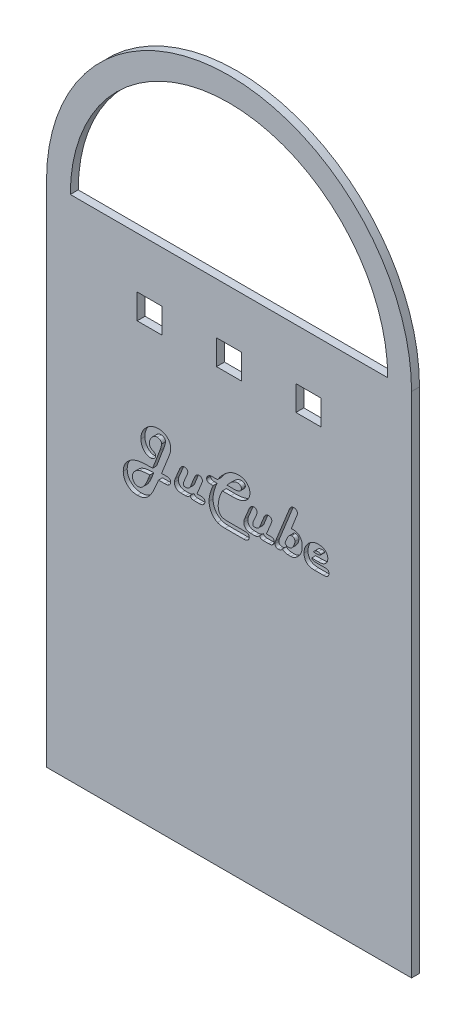
from build123d import *

# Parameters (mm, degrees)
SKETCH2_W           = 10
SKETCH2_H           = 10
BOSS_EXTRUDE5_DEPTH = 3.175
CUT_EXTRUDE2_DEPTH  = 1.5875


with BuildPart() as part:
    # Sketch2 → Boss-Extrude5 (new body)
    with BuildSketch(Plane.XY):
        with BuildLine():
            Line((0, 0), (146.05, 0))
            Line((146.05, 0), (146.05, 203.2))
            ThreePointArc((146.05, 203.2), (73.025, 276.225), (0, 203.2))
            Line((0, 203.2), (0, 0))
        make_face()
        with BuildLine():
            Line((9.525, 203.2), (136.525, 203.2))
            ThreePointArc((136.525, 203.2), (73.025, 266.7), (9.525, 203.2))
        make_face(mode=Mode.SUBTRACT)
        with Locations((41.275, 177.8)):
            Rectangle(SKETCH2_W, SKETCH2_H, mode=Mode.SUBTRACT)
        with Locations((73.025, 177.8)):
            Rectangle(SKETCH2_W, SKETCH2_H, mode=Mode.SUBTRACT)
        with Locations((104.775, 177.8)):
            Rectangle(SKETCH2_W, SKETCH2_H, mode=Mode.SUBTRACT)
    extrude(amount=BOSS_EXTRUDE5_DEPTH)

    # Sketch4 → Cut-Extrude2 (cut)
    # profile 1 of 6: a face of its own
    with BuildSketch(Plane.XY.offset(3.175)):
        with BuildLine():
            Line((46.031308631, 124.822674221), (47.941745275, 124.822674221))
            add(Edge.make_bspline(
                [(47.941745275, 124.822674221), (48.080294818, 124.819712051), (48.339712051, 124.814165747), (48.699868235, 124.756454284), (49.008684519, 124.66955094), (49.260364084, 124.534228572), (49.463707014, 124.365336185), (49.604231405, 124.150526071), (49.69180785, 123.899345289), (49.69965441, 123.718535617), (49.703761542, 123.623894255)],
                knots=[0, 0, 0, 0, 1.374766829, 2.57408433, 3.614346374, 4.544477883, 5.393131557, 6.21082457, 7.063490371, 8, 8, 8, 8], degree=3))
            add(Edge.make_bspline(
                [(49.703761542, 123.623894255), (49.697396484, 123.49602033), (49.685062487, 123.248230528), (49.561319384, 122.898163915), (49.357922028, 122.594266718), (49.077603043, 122.340136992), (48.728091218, 122.143366324), (48.319254627, 121.997884124), (47.848445679, 121.917228721), (47.515815362, 121.905904586), (47.340452467, 121.899934495)],
                knots=[0, 0, 0, 0, 0.929567561, 1.801284846, 2.668377082, 3.571806983, 4.533225673, 5.574775137, 6.721420051, 8, 8, 8, 8], degree=3))
            Line((47.340452467, 121.899934495), (44.821111714, 121.899934495))
            Line((44.821111714, 121.899934495), (43.862087741, 119.53662542))
            add(Edge.make_bspline(
                [(43.862087741, 119.53662542), (43.734031349, 119.220911014), (43.48627451, 118.610083221), (43.083855351, 117.740867242), (42.681335469, 116.942614562), (42.280934505, 116.210746535), (41.865172802, 115.557615623), (41.450118653, 114.972071586), (41.034685243, 114.454518334), (40.602867664, 114.012652023), (40.159679198, 113.627087468), (39.689882094, 113.301089703), (39.197379202, 113.019218246), (38.674018061, 112.795280128), (38.12704459, 112.615241294), (37.551993377, 112.48967888), (36.95160052, 112.41767564), (36.542746058, 112.406647284), (36.334510686, 112.401030385)],
                knots=[0, 0, 0, 0, 1.468908974, 2.841968597, 4.1287121, 5.323593136, 6.437448851, 7.465024802, 8.417576394, 9.295662056, 10.125698866, 10.94665604, 11.757436234, 12.568345582, 13.39692117, 14.237044157, 15.102101602, 16, 16, 16, 16], degree=3))
            add(Edge.make_bspline(
                [(36.334510686, 112.401030385), (36.137589531, 112.404477258), (35.75107336, 112.411242767), (35.184820769, 112.492385338), (34.64243405, 112.61116092), (34.12504618, 112.78443444), (33.632183955, 113.004925182), (33.165017373, 113.278031836), (32.72201072, 113.59842844), (32.309672983, 113.966347551), (31.935331224, 114.370673892), (31.606409204, 114.802575398), (31.32451665, 115.257197489), (31.101925243, 115.740731339), (30.920051192, 116.243921441), (30.794589163, 116.773658535), (30.72270625, 117.327356192), (30.711598915, 117.704630481), (30.705953323, 117.896389974)],
                knots=[0, 0, 0, 0, 1.074409005, 2.108846326, 3.117072076, 4.102727955, 5.08240308, 6.060117382, 7.05212911, 8.062778769, 9.072478569, 10.056063612, 11.023046353, 11.986724094, 12.957247774, 13.940052078, 14.952977764, 16, 16, 16, 16], degree=3))
            add(Edge.make_bspline(
                [(30.705953323, 117.896389974), (30.708705247, 118.042411483), (30.714151017, 118.331372744), (30.762923108, 118.759569252), (30.833550543, 119.179635621), (30.937107566, 119.591711571), (31.070463187, 119.996269011), (31.234665585, 120.391163326), (31.425516526, 120.778307478), (31.646900947, 121.153809422), (31.892461809, 121.519114946), (32.168540556, 121.866584279), (32.469834737, 122.197116295), (32.792922626, 122.513308526), (33.140316389, 122.812082061), (33.515204363, 123.08825825), (33.911385368, 123.353621282), (34.190881904, 123.51270647), (34.332738426, 123.59344905)],
                knots=[0, 0, 0, 0, 0.986633776, 1.952444828, 2.909577263, 3.864094578, 4.821227013, 5.786162288, 6.752467993, 7.73626618, 8.730323382, 9.725267674, 10.732877573, 11.751517376, 12.779174888, 13.826952509, 14.897084866, 16, 16, 16, 16], degree=3))
            add(Edge.make_bspline(
                [(34.332738426, 123.59344905), (34.523974716, 123.690830636), (34.915407749, 123.890156661), (35.5493386, 124.129380854), (36.230779762, 124.341426386), (36.967442276, 124.503827471), (37.753020843, 124.640095211), (38.592286442, 124.726446681), (39.483448447, 124.786347867), (40.095652231, 124.792745758), (40.41036257, 124.796034666)],
                knots=[0, 0, 0, 0, 0.822641494, 1.683828184, 2.595046862, 3.558297765, 4.575076227, 5.651965759, 6.792966211, 8, 8, 8, 8], degree=3))
            Line((40.41036257, 124.796034666), (42.457802638, 124.822674221))
            Line((42.457802638, 124.822674221), (45.315846303, 132.338834324))
            add(Edge.make_bspline(
                [(45.315846303, 132.338834324), (45.373565588, 132.495911057), (45.483590688, 132.795332351), (45.631175441, 133.22739868), (45.763365647, 133.617780821), (45.865587471, 133.972483942), (45.946245959, 134.287158611), (46.004262768, 134.562483476), (46.041924723, 134.798791081), (46.047710386, 134.94433087), (46.050336885, 135.010401105)],
                knots=[0, 0, 0, 0, 1.444318592, 2.753175028, 3.940779609, 5.001085105, 5.938491443, 6.743748221, 7.429703383, 8, 8, 8, 8], degree=3))
            add(Edge.make_bspline(
                [(46.050336885, 135.010401105), (46.045351981, 135.109046088), (46.035437799, 135.30523532), (45.92768989, 135.584825196), (45.765960289, 135.845554974), (45.538757287, 136.073406673), (45.274727639, 136.26980574), (44.975347082, 136.413468956), (44.65089449, 136.499982658), (44.425857603, 136.509024451), (44.311154522, 136.513633125)],
                knots=[0, 0, 0, 0, 0.926502715, 1.842667016, 2.789054029, 3.8047205, 4.857979717, 5.880393009, 6.919619551, 8, 8, 8, 8], degree=3))
            add(Edge.make_bspline(
                [(44.311154522, 136.513633125), (44.21322501, 136.50978514), (44.018465936, 136.502132391), (43.729843603, 136.446065184), (43.447522694, 136.358696049), (43.170970063, 136.235958669), (42.902767636, 136.07464067), (42.645512329, 135.873314686), (42.387620959, 135.645370203), (42.144788648, 135.381301358), (41.921248873, 135.09657287), (41.718571178, 134.803223347), (41.558045077, 134.496677445), (41.417069581, 134.186965379), (41.31122918, 133.866528377), (41.235428071, 133.539149721), (41.187457578, 133.204131763), (41.181912066, 132.978344896), (41.179104008, 132.864014118)],
                knots=[0, 0, 0, 0, 0.890503997, 1.771005816, 2.665315563, 3.574615816, 4.516720043, 5.504645526, 6.542601364, 7.645023422, 8.762504704, 9.834794883, 10.882965811, 11.905928596, 12.927784102, 13.946768121, 14.960313327, 16, 16, 16, 16], degree=3))
            add(Edge.make_bspline(
                [(41.179104008, 132.864014118), (41.183459682, 132.745752321), (41.191820945, 132.518733964), (41.255556535, 132.197051896), (41.363869637, 131.912954263), (41.514027846, 131.658510772), (41.732162806, 131.441817649), (42.00264807, 131.239294101), (42.335353617, 131.049605688), (42.584651146, 130.94450425), (42.716586885, 130.888881413)],
                knots=[0, 0, 0, 0, 1.048922844, 2.013539002, 2.893545401, 3.737095429, 4.612700145, 5.600929284, 6.730339736, 8, 8, 8, 8], degree=3))
            add(Edge.make_bspline(
                [(42.716586885, 130.888881413), (42.787229109, 130.857601104), (42.923599432, 130.797216456), (43.107649457, 130.681787206), (43.264897175, 130.5533936), (43.391917555, 130.410043904), (43.495802401, 130.255693042), (43.561797801, 130.082283855), (43.605770943, 129.8977771), (43.611699637, 129.770284516), (43.614720446, 129.70532405)],
                knots=[0, 0, 0, 0, 1.167516901, 2.25381717, 3.276011108, 4.227479954, 5.143046177, 6.073179368, 7.018239636, 8, 8, 8, 8], degree=3))
            add(Edge.make_bspline(
                [(43.614720446, 129.70532405), (43.608305359, 129.58791453), (43.595701002, 129.357228447), (43.490669382, 129.025830332), (43.307379666, 128.731612166), (43.069862165, 128.468669661), (42.775739564, 128.25889965), (42.44680605, 128.096937086), (42.079530905, 128.005666978), (41.824008264, 127.99463666), (41.692866851, 127.988975591)],
                knots=[0, 0, 0, 0, 0.979783024, 1.925076521, 2.866678614, 3.857011038, 4.866165817, 5.866431161, 6.904992405, 8, 8, 8, 8], degree=3))
            add(Edge.make_bspline(
                [(41.692866851, 127.988975591), (41.559456495, 127.993905884), (41.296329437, 128.003629968), (40.908821887, 128.064602702), (40.536394631, 128.171187311), (40.181403713, 128.327457968), (39.837076785, 128.515792079), (39.510472723, 128.752789376), (39.198629826, 129.030012905), (38.908539904, 129.350009466), (38.64112885, 129.695159895), (38.40488297, 130.063121189), (38.213915157, 130.453587968), (38.047638772, 130.856460812), (37.920752832, 131.279551703), (37.835798143, 131.720871806), (37.780360095, 132.18013834), (37.772990178, 132.492165119), (37.769240994, 132.65089768)],
                knots=[0, 0, 0, 0, 0.946241094, 1.866284174, 2.774639195, 3.685486034, 4.61179857, 5.553107829, 6.54086954, 7.566109643, 8.611676729, 9.635020141, 10.661049498, 11.690229817, 12.72349202, 13.78747785, 14.874457807, 16, 16, 16, 16], degree=3))
            add(Edge.make_bspline(
                [(37.769240994, 132.65089768), (37.775884107, 132.88341589), (37.789013635, 133.342967741), (37.891718626, 134.019775922), (38.053329736, 134.675127997), (38.289928563, 135.304146372), (38.580433346, 135.915284016), (38.953227942, 136.493481292), (39.37935859, 137.056937371), (39.870035427, 137.587164749), (40.406285216, 138.07112403), (40.963988873, 138.508543329), (41.555619179, 138.863473666), (42.162404456, 139.167244217), (42.79883242, 139.392571237), (43.453655786, 139.563857919), (44.134599604, 139.658659246), (44.595038525, 139.672771942), (44.828723015, 139.679934495)],
                knots=[0, 0, 0, 0, 1.011155103, 1.998459391, 2.971548179, 3.942380816, 4.917345741, 5.909496761, 6.929394283, 7.987804135, 9.046559243, 10.069810793, 11.065516384, 12.042899322, 13.017020432, 13.996815416, 14.983332755, 16, 16, 16, 16], degree=3))
            add(Edge.make_bspline(
                [(44.828723015, 139.679934495), (44.998895077, 139.676694863), (45.334029986, 139.670314769), (45.824274659, 139.607759865), (46.293683017, 139.507602856), (46.7426278, 139.373674393), (47.1680906, 139.191246377), (47.572583724, 138.974665756), (47.956119377, 138.718539177), (48.311225558, 138.421934016), (48.636467367, 138.097491335), (48.924023648, 137.750915823), (49.165682306, 137.383521675), (49.361554191, 136.995071344), (49.513497719, 136.586385249), (49.624856043, 136.158236786), (49.690306286, 135.708850453), (49.69921595, 135.402597601), (49.703761542, 135.246351447)],
                knots=[0, 0, 0, 0, 1.10911317, 2.184274766, 3.216023009, 4.236436679, 5.233451808, 6.228921843, 7.224529316, 8.234836295, 9.240800183, 10.216171666, 11.165921024, 12.10177449, 13.046612937, 14.003538441, 14.981431716, 16, 16, 16, 16], degree=3))
            add(Edge.make_bspline(
                [(49.703761542, 135.246351447), (49.694848198, 135.033975958), (49.676083868, 134.586884079), (49.539967255, 133.888591697), (49.325440086, 133.131175502), (49.131798374, 132.614059429), (49.030161371, 132.342639974)],
                knots=[0, 0, 0, 0, 0.850166335, 1.789766162, 2.839911396, 4, 4, 4, 4], degree=3))
            Line((49.030161371, 132.342639974), (46.031308631, 124.822674221))
        make_face()
        with BuildLine():
            add(Edge.make_bspline(
                [(41.316107433, 121.899934495), (41.099143122, 121.899075357), (40.678990975, 121.897411634), (40.068800464, 121.867545952), (39.497339324, 121.832707959), (38.963866412, 121.776422024), (38.47059153, 121.698905574), (38.014966495, 121.613925141), (37.599169533, 121.508411151), (37.338728499, 121.420697064), (37.213615994, 121.378560351)],
                knots=[0, 0, 0, 0, 1.253277197, 2.426975682, 3.528706619, 4.560583597, 5.524511111, 6.412754989, 7.237508024, 8, 8, 8, 8], degree=3))
            add(Edge.make_bspline(
                [(37.213615994, 121.378560351), (37.001651897, 121.295412372), (36.589897071, 121.13389171), (36.031441397, 120.80399978), (35.537359856, 120.430437391), (35.118628315, 120.005276198), (34.781284975, 119.541759871), (34.534934982, 119.047755312), (34.389702583, 118.526123991), (34.36950115, 118.169992707), (34.359377981, 117.991531241)],
                knots=[0, 0, 0, 0, 1.156315915, 2.246223131, 3.286242349, 4.299011665, 5.269472516, 6.189856709, 7.092916461, 8, 8, 8, 8], degree=3))
            add(Edge.make_bspline(
                [(34.359377981, 117.991531241), (34.367196353, 117.828338387), (34.382455192, 117.509840718), (34.508787977, 117.052365048), (34.713622858, 116.633841798), (34.99424674, 116.263338097), (35.333851793, 115.954516183), (35.719875495, 115.729111552), (36.144301989, 115.593415578), (36.438814005, 115.576159921), (36.589489282, 115.567331755)],
                knots=[0, 0, 0, 0, 1.06797539, 2.084329447, 3.084404886, 4.105236595, 5.111786419, 6.072782716, 7.01401647, 8, 8, 8, 8], degree=3))
            add(Edge.make_bspline(
                [(36.589489282, 115.567331755), (36.687382973, 115.569928877), (36.881919132, 115.575089925), (37.169435783, 115.626767968), (37.449368081, 115.710488302), (37.720127746, 115.830540523), (37.985016049, 115.97942611), (38.240924972, 116.163847948), (38.487584375, 116.382228576), (38.7301003, 116.632222674), (38.966713631, 116.920747283), (39.201343586, 117.248540005), (39.436742193, 117.614776349), (39.673907249, 118.018597245), (39.904811252, 118.465726354), (40.135517417, 118.952499021), (40.369697862, 119.477850083), (40.51454082, 119.845558961), (40.589228152, 120.035165659)],
                knots=[0, 0, 0, 0, 0.738169037, 1.466903219, 2.196831274, 2.938530611, 3.6973333, 4.486394525, 5.314063054, 6.180681392, 7.112286698, 8.127279707, 9.221365764, 10.39702258, 11.660243416, 13.017718709, 14.462205991, 16, 16, 16, 16], degree=3))
            Line((40.589228152, 120.035165659), (41.316107433, 121.899934495))
        make_face(mode=Mode.SUBTRACT)
    # profile 2 of 6: a face of its own
    with BuildSketch(Plane.XY.offset(3.175)):
        with BuildLine():
            Line((60.211163083, 124.822674221), (61.699172501, 124.822674221))
            add(Edge.make_bspline(
                [(61.699172501, 124.822674221), (61.837690494, 124.821078634), (62.094389144, 124.818121726), (62.445626689, 124.764507655), (62.736225556, 124.685211155), (62.966912385, 124.562640149), (63.139634218, 124.394012184), (63.261201017, 124.182625195), (63.333088302, 123.926551806), (63.339709135, 123.741089343), (63.343213597, 123.642922509)],
                knots=[0, 0, 0, 0, 1.423474627, 2.637953448, 3.6454745, 4.509973129, 5.294422611, 6.095734663, 6.992056419, 8, 8, 8, 8], degree=3))
            add(Edge.make_bspline(
                [(63.343213597, 123.642922509), (63.338040532, 123.512586392), (63.32809045, 123.261892652), (63.212197122, 122.910606437), (63.028864791, 122.603694766), (62.7727829, 122.345841431), (62.450744602, 122.143557073), (62.069756465, 121.997790608), (61.631451817, 121.917522824), (61.321466938, 121.90598839), (61.158770104, 121.899934495)],
                knots=[0, 0, 0, 0, 0.986942706, 1.898325388, 2.776060673, 3.682537368, 4.631717883, 5.644811449, 6.76386964, 8, 8, 8, 8], degree=3))
            Line((61.158770104, 121.899934495), (58.86015709, 121.899934495))
            add(Edge.make_bspline(
                [(58.86015709, 121.899934495), (58.773775927, 121.90333364), (58.607755267, 121.909866642), (58.369064833, 121.946237558), (58.152655451, 122.014454756), (57.961407076, 122.115105954), (57.79058715, 122.239033342), (57.639066036, 122.387783446), (57.51725222, 122.571093382), (57.45412892, 122.705840766), (57.421621131, 122.775234152)],
                knots=[0, 0, 0, 0, 1.152361497, 2.214786302, 3.209888758, 4.163277449, 5.083675317, 6.016734849, 6.978640777, 8, 8, 8, 8], degree=3))
            add(Edge.make_bspline(
                [(57.421621131, 122.775234152), (57.361884058, 122.705691532), (57.245409113, 122.570097797), (57.054485612, 122.387874054), (56.847038499, 122.239091819), (56.628738254, 122.118354262), (56.402712337, 122.015247264), (56.162662042, 121.948146589), (55.910729779, 121.909996539), (55.739655748, 121.903343607), (55.651993563, 121.899934495)],
                knots=[0, 0, 0, 0, 1.074888274, 2.095809936, 3.086807958, 4.059318953, 5.018538645, 5.993322927, 6.971733483, 8, 8, 8, 8], degree=3))
            Line((55.651993563, 121.899934495), (53.775807775, 121.899934495))
            add(Edge.make_bspline(
                [(53.775807775, 121.899934495), (53.594799408, 121.906965616), (53.244246215, 121.920582566), (52.744419231, 122.054832813), (52.292381, 122.27099887), (51.897527121, 122.571515924), (51.573861202, 122.939413818), (51.334780628, 123.360856362), (51.188643023, 123.830087168), (51.173088959, 124.159440471), (51.165131405, 124.327939632)],
                knots=[0, 0, 0, 0, 1.087915245, 2.106931136, 3.090844651, 4.088450258, 5.073608295, 6.02105831, 6.987561346, 8, 8, 8, 8], degree=3))
            add(Edge.make_bspline(
                [(51.165131405, 124.327939632), (51.168567096, 124.43228533), (51.175792146, 124.651718068), (51.247763951, 124.989825784), (51.34918805, 125.354523065), (51.445649263, 125.599814812), (51.496223015, 125.728419084)],
                knots=[0, 0, 0, 0, 0.863914828, 1.816760999, 2.8553473, 4, 4, 4, 4], degree=3))
            Line((51.496223015, 125.728419084), (53.227794077, 129.903217885))
            add(Edge.make_bspline(
                [(53.227794077, 129.903217885), (53.288755051, 130.040168975), (53.405223719, 130.301820155), (53.610507974, 130.657126468), (53.832748882, 130.961057821), (54.075361931, 131.207792743), (54.333279225, 131.406056995), (54.612972565, 131.53820091), (54.906774873, 131.629232414), (55.110895432, 131.637971354), (55.214343734, 131.642400248)],
                knots=[0, 0, 0, 0, 1.280028315, 2.445551341, 3.499011175, 4.487645763, 5.393702846, 6.261350057, 7.118852184, 8, 8, 8, 8], degree=3))
            add(Edge.make_bspline(
                [(55.214343734, 131.642400248), (55.302396849, 131.63979896), (55.473504089, 131.634744065), (55.717293548, 131.564728088), (55.944071298, 131.462747129), (56.14120368, 131.313892526), (56.310251856, 131.141076076), (56.435547901, 130.943612861), (56.512032266, 130.724310405), (56.519623771, 130.571081602), (56.52348757, 130.493093741)],
                knots=[0, 0, 0, 0, 1.088377808, 2.114965752, 3.121466735, 4.15669776, 5.158144943, 6.10535726, 7.035696088, 8, 8, 8, 8], degree=3))
            add(Edge.make_bspline(
                [(56.52348757, 130.493093741), (56.521322346, 130.430763444), (56.516778277, 130.299953336), (56.475421756, 130.097192824), (56.410677956, 129.881085974), (56.352170818, 129.735341362), (56.321788083, 129.659656241)],
                knots=[0, 0, 0, 0, 0.865948269, 1.817331053, 2.86654086, 4, 4, 4, 4], degree=3))
            Line((56.321788083, 129.659656241), (56.184784659, 129.336175933))
            Line((56.184784659, 129.336175933), (54.868029522, 126.230764974))
            Line((54.868029522, 126.230764974), (54.841389967, 125.861616858))
            add(Edge.make_bspline(
                [(54.841389967, 125.861616858), (54.835870116, 125.767764593), (54.826399812, 125.606744027), (54.820864902, 125.445542858), (54.818556063, 125.378299221)],
                knots=[0, 0, 0, 0, 1.165717742, 2, 2, 2, 2], degree=3))
            add(Edge.make_bspline(
                [(54.818556063, 125.378299221), (54.817659313, 125.334950761), (54.815944017, 125.252034174), (54.847707105, 125.13604467), (54.901326092, 125.035366597), (54.986221068, 124.958291169), (55.091383689, 124.897069903), (55.21885044, 124.851478846), (55.370581739, 124.825280239), (55.47935919, 124.823585237), (55.537824042, 124.822674221)],
                knots=[0, 0, 0, 0, 0.989944688, 1.893558305, 2.727461867, 3.571461481, 4.484864337, 5.506805255, 6.659977222, 8, 8, 8, 8], degree=3))
            add(Edge.make_bspline(
                [(55.537824042, 124.822674221), (55.661081472, 124.82615161), (55.898873679, 124.8328603), (56.240047707, 124.888937241), (56.547874078, 124.98805595), (56.822858223, 125.126673629), (57.065904472, 125.30403444), (57.277397501, 125.519371987), (57.45639685, 125.775452296), (57.543895417, 125.967810182), (57.589069762, 126.067121995)],
                knots=[0, 0, 0, 0, 1.152998018, 2.224400943, 3.222961798, 4.167941497, 5.093941346, 6.025705995, 6.980698316, 8, 8, 8, 8], degree=3))
            Line((57.589069762, 126.067121995), (59.141775241, 129.899412235))
            add(Edge.make_bspline(
                [(59.141775241, 129.899412235), (59.200342769, 130.036215182), (59.312122776, 130.297312669), (59.509346697, 130.655953808), (59.730894512, 130.957838123), (59.966425607, 131.208719276), (60.221353103, 131.40686602), (60.500363043, 131.538103978), (60.794103933, 131.629257306), (60.998232821, 131.637979726), (61.101685344, 131.642400248)],
                knots=[0, 0, 0, 0, 1.276554646, 2.436389105, 3.503204744, 4.481005901, 5.382319852, 6.253756509, 7.115003774, 8, 8, 8, 8], degree=3))
            add(Edge.make_bspline(
                [(61.101685344, 131.642400248), (61.18584935, 131.637968101), (61.350433978, 131.629300935), (61.588704016, 131.561886726), (61.807332734, 131.45086569), (62.00030834, 131.297483568), (62.162625766, 131.118147444), (62.285554591, 130.91661263), (62.35650507, 130.693070778), (62.364756367, 130.53798401), (62.368967022, 130.458842885)],
                knots=[0, 0, 0, 0, 1.048999871, 2.051343087, 3.063635363, 4.089572167, 5.109631033, 6.067886396, 7.014038103, 8, 8, 8, 8], degree=3))
            add(Edge.make_bspline(
                [(62.368967022, 130.458842885), (62.36460162, 130.384995504), (62.354705418, 130.217586279), (62.287034124, 129.944057056), (62.182558597, 129.618050358), (62.091396312, 129.386395586), (62.041681063, 129.26006292)],
                knots=[0, 0, 0, 0, 0.709652047, 1.608754381, 2.695936919, 4, 4, 4, 4], degree=3))
            Line((62.041681063, 129.26006292), (60.211163083, 124.822674221))
        make_face()
    # profile 3 of 6: a face of its own
    with BuildSketch(Plane.XY.offset(3.175)):
        with BuildLine():
            add(Edge.make_bspline(
                [(70.345610857, 130.911715317), (70.215073437, 130.650275216), (69.959140505, 130.137693222), (69.623802636, 129.364623356), (69.341041487, 128.604799591), (69.107842292, 127.860798713), (68.9279341, 127.129844955), (68.796944874, 126.413372483), (68.718748822, 125.709864164), (68.707233837, 125.245283695), (68.701569762, 125.016762406)],
                knots=[0, 0, 0, 0, 1.135220372, 2.225724058, 3.27216563, 4.283906486, 5.253382005, 6.19501987, 7.112152981, 8, 8, 8, 8], degree=3))
            add(Edge.make_bspline(
                [(68.701569762, 125.016762406), (68.702899968, 124.861881627), (68.70547855, 124.561647952), (68.74954277, 124.129590033), (68.812695383, 123.7298997), (68.901619339, 123.364601027), (69.022444069, 123.034710223), (69.158777263, 122.734216226), (69.334938845, 122.474548419), (69.528023702, 122.2407957), (69.760273661, 122.043680706), (70.0218978, 121.872559656), (70.32120925, 121.73146447), (70.651434551, 121.614652023), (71.01706517, 121.522648128), (71.417202501, 121.461363506), (71.851642176, 121.416471314), (72.153165999, 121.414060025), (72.309326611, 121.412811207)],
                knots=[0, 0, 0, 0, 1.252459074, 2.42786996, 3.509382925, 4.524948922, 5.463153721, 6.349162468, 7.186018239, 7.994189337, 8.794568284, 9.640001636, 10.516748818, 11.46461486, 12.470227408, 13.561870161, 14.737281046, 16, 16, 16, 16], degree=3))
            Line((72.309326611, 121.412811207), (79.452532946, 121.412811207))
            add(Edge.make_bspline(
                [(79.452532946, 121.412811207), (79.583429731, 121.409470851), (79.828687642, 121.403212113), (80.171228233, 121.349765132), (80.464146133, 121.267199108), (80.705368193, 121.139418956), (80.893063812, 120.971988477), (81.032002532, 120.769467295), (81.109109415, 120.526237419), (81.118349738, 120.354108669), (81.123213597, 120.2635047)],
                knots=[0, 0, 0, 0, 1.364402225, 2.556445067, 3.607043229, 4.52467117, 5.377329535, 6.206674295, 7.056041324, 8, 8, 8, 8], degree=3))
            add(Edge.make_bspline(
                [(81.123213597, 120.2635047), (81.116460174, 120.130690108), (81.103533168, 119.876464228), (80.988750932, 119.517279341), (80.797966049, 119.204195595), (80.529127969, 118.944056422), (80.195424852, 118.734546581), (79.796330103, 118.594204859), (79.340983112, 118.505538112), (79.017883794, 118.495412954), (78.847434488, 118.490071481)],
                knots=[0, 0, 0, 0, 0.975907244, 1.868024237, 2.744304013, 3.649190112, 4.597713907, 5.623187205, 6.746125208, 8, 8, 8, 8], degree=3))
            Line((78.847434488, 118.490071481), (71.399776097, 118.490071481))
            add(Edge.make_bspline(
                [(71.399776097, 118.490071481), (71.24749257, 118.490976351), (70.950287347, 118.492742346), (70.516421085, 118.522614017), (70.104620898, 118.557722157), (69.716721163, 118.613621714), (69.353385294, 118.692933223), (69.011167669, 118.776495059), (68.693479689, 118.88362319), (68.49426961, 118.969543513), (68.397117707, 119.011445625)],
                knots=[0, 0, 0, 0, 1.190131533, 2.322728638, 3.398279404, 4.420629422, 5.383336324, 6.304493289, 7.173125649, 8, 8, 8, 8], degree=3))
            add(Edge.make_bspline(
                [(68.397117707, 119.011445625), (68.269223917, 119.074203046), (68.016082279, 119.198419525), (67.656277806, 119.417948405), (67.316171926, 119.661736034), (66.998563702, 119.932084954), (66.698121258, 120.221934629), (66.423693345, 120.540429576), (66.169410442, 120.883423902), (65.933583425, 121.247143605), (65.723506416, 121.630786962), (65.547707551, 122.032585816), (65.386505179, 122.442790893), (65.269642446, 122.871513938), (65.16714917, 123.308627745), (65.100731389, 123.760568892), (65.057293353, 124.22560372), (65.051223569, 124.540954332), (65.048145104, 124.700893399)],
                knots=[0, 0, 0, 0, 0.978821428, 1.937392436, 2.893262791, 3.852309596, 4.801915283, 5.760010259, 6.738365507, 7.734854603, 8.737656672, 9.740761978, 10.748065266, 11.763749894, 12.791822966, 13.832648446, 14.900765778, 16, 16, 16, 16], degree=3))
            add(Edge.make_bspline(
                [(65.048145104, 124.700893399), (65.054150295, 124.923055137), (65.066463911, 125.378596744), (65.141387151, 126.078038933), (65.267286796, 126.808912786), (65.450080852, 127.569628263), (65.67291304, 128.36336487), (65.954838936, 129.185765866), (66.280292398, 130.042206103), (66.52998477, 130.617113751), (66.657935344, 130.911715317)],
                knots=[0, 0, 0, 0, 0.825338176, 1.692352082, 2.610409369, 3.578574102, 4.597433625, 5.671882489, 6.806996102, 8, 8, 8, 8], degree=3))
            Line((66.657935344, 130.911715317), (65.938667364, 130.911715317))
            Line((65.938667364, 130.911715317), (65.603770104, 130.911715317))
            add(Edge.make_bspline(
                [(65.603770104, 130.911715317), (65.484318735, 130.9152856), (65.259306533, 130.922010992), (64.944711478, 130.973179846), (64.676063768, 131.062420678), (64.456821476, 131.194388661), (64.28234204, 131.362234381), (64.157702585, 131.570477713), (64.084456852, 131.816493899), (64.077525859, 131.992003114), (64.073898529, 132.083855728)],
                knots=[0, 0, 0, 0, 1.304291175, 2.456911397, 3.46914742, 4.376890703, 5.229335235, 6.087167935, 6.998920798, 8, 8, 8, 8], degree=3))
            add(Edge.make_bspline(
                [(64.073898529, 132.083855728), (64.080334396, 132.203015271), (64.092995613, 132.43743664), (64.221129355, 132.769213411), (64.414172736, 133.074565603), (64.688804746, 133.336025503), (65.010826846, 133.560095591), (65.37808789, 133.720369346), (65.777424614, 133.819433574), (66.05477646, 133.829352537), (66.197451611, 133.834455043)],
                knots=[0, 0, 0, 0, 0.93209166, 1.833694528, 2.756955055, 3.750515861, 4.789799231, 5.824869921, 6.881071041, 8, 8, 8, 8], degree=3))
            Line((66.197451611, 133.834455043), (66.543765823, 133.834455043))
            Line((66.543765823, 133.834455043), (68.404729008, 133.834455043))
            add(Edge.make_bspline(
                [(68.404729008, 133.834455043), (68.610045138, 134.150292291), (69.029510419, 134.795554602), (69.772664586, 135.711166898), (70.60125062, 136.620576878), (71.217601093, 137.186759659), (71.532973871, 137.476462748)],
                knots=[0, 0, 0, 0, 0.937855809, 1.916059648, 2.933694244, 4, 4, 4, 4], degree=3))
            add(Edge.make_bspline(
                [(71.532973871, 137.476462748), (71.740475639, 137.6529674), (72.147524901, 137.999210656), (72.800182821, 138.442018925), (73.457266659, 138.82762428), (74.13286233, 139.136110748), (74.817974342, 139.383225184), (75.518549879, 139.553120147), (76.229616834, 139.660486275), (76.708280458, 139.673437279), (76.948414796, 139.679934495)],
                knots=[0, 0, 0, 0, 1.092661291, 2.143437016, 3.160869329, 4.147355701, 5.120066962, 6.07960259, 7.036581562, 8, 8, 8, 8], degree=3))
            add(Edge.make_bspline(
                [(76.948414796, 139.679934495), (77.104604689, 139.676179648), (77.410301823, 139.668830607), (77.858387667, 139.614140272), (78.286162017, 139.526855265), (78.694953788, 139.406433787), (79.082555849, 139.24518071), (79.446823186, 139.046246464), (79.793811476, 138.816745933), (80.114141167, 138.551649018), (80.406279474, 138.260164437), (80.664537773, 137.946454986), (80.880172721, 137.610613835), (81.062932583, 137.257928299), (81.200073336, 136.883033996), (81.292504542, 136.487864859), (81.357739742, 136.075590371), (81.363728101, 135.793361077), (81.366775241, 135.64975042)],
                knots=[0, 0, 0, 0, 1.119470347, 2.191043674, 3.230811999, 4.246439411, 5.241169613, 6.234027478, 7.217680394, 8.219039442, 9.209311844, 10.172275427, 11.125745502, 12.0652356, 13.014663964, 13.978528858, 14.971386723, 16, 16, 16, 16], degree=3))
            add(Edge.make_bspline(
                [(81.366775241, 135.64975042), (81.359836523, 135.446229411), (81.346276849, 135.04850778), (81.229200845, 134.47139858), (81.036631466, 133.932691891), (80.771765075, 133.427128907), (80.426477451, 132.959988582), (80.000165667, 132.53683784), (79.50566026, 132.142217823), (79.132129365, 131.923215838), (78.938770104, 131.809848878)],
                knots=[0, 0, 0, 0, 1.018804761, 1.990952639, 2.935710558, 3.876656104, 4.840123917, 5.833253974, 6.878378157, 8, 8, 8, 8], degree=3))
            add(Edge.make_bspline(
                [(78.938770104, 131.809848878), (78.792906553, 131.737124415), (78.487456363, 131.584833448), (77.979729597, 131.406203819), (77.413948815, 131.25070931), (76.78645108, 131.127695728), (76.100715554, 131.028359769), (75.35360692, 130.962927997), (74.54627479, 130.9203776), (73.987677857, 130.914670787), (73.698389111, 130.911715317)],
                knots=[0, 0, 0, 0, 0.728556699, 1.525657243, 2.402672044, 3.352039263, 4.384154211, 5.50114961, 6.705883877, 8, 8, 8, 8], degree=3))
            Line((73.698389111, 130.911715317), (70.345610857, 130.911715317))
        make_face()
        with BuildLine():
            Line((72.259853152, 133.834455043), (74.7487487, 133.834455043))
            add(Edge.make_bspline(
                [(74.7487487, 133.834455043), (74.878151436, 133.83625543), (75.129486623, 133.839752269), (75.49285044, 133.856869859), (75.83154176, 133.893100753), (76.145971442, 133.935782424), (76.435236546, 133.997919706), (76.69961442, 134.067895762), (76.93672947, 134.157081324), (77.151863707, 134.25502457), (77.34187457, 134.367354316), (77.505210456, 134.496942286), (77.64672408, 134.63469212), (77.759278374, 134.791422524), (77.846589732, 134.959678512), (77.913020826, 135.140774981), (77.951403626, 135.336064012), (77.955051808, 135.470718468), (77.956912227, 135.53938655)],
                knots=[0, 0, 0, 0, 1.530225532, 2.972112734, 4.29893874, 5.556827136, 6.721764215, 7.795238361, 8.787123859, 9.713203311, 10.587806911, 11.388973238, 12.173826602, 12.91489056, 13.659588691, 14.409255044, 15.188787307, 16, 16, 16, 16], degree=3))
            add(Edge.make_bspline(
                [(77.956912227, 135.53938655), (77.951658619, 135.624884128), (77.941398597, 135.791856427), (77.864333495, 136.031901246), (77.724353282, 136.240714383), (77.541429214, 136.424420155), (77.315401134, 136.569746999), (77.062715266, 136.684402825), (76.777217751, 136.743131021), (76.579491035, 136.752378593), (76.476514111, 136.757194769)],
                knots=[0, 0, 0, 0, 0.957969228, 1.870863791, 2.785970899, 3.751300333, 4.757052917, 5.782222404, 6.844971886, 8, 8, 8, 8], degree=3))
            add(Edge.make_bspline(
                [(76.476514111, 136.757194769), (76.306802922, 136.747078038), (75.956193182, 136.726177682), (75.425555976, 136.565173824), (74.880913117, 136.309013373), (74.322679616, 135.962907572), (73.768421006, 135.535434313), (73.234437721, 135.03361028), (72.726476523, 134.464398733), (72.417732076, 134.047592314), (72.259853152, 133.834455043)],
                knots=[0, 0, 0, 0, 0.767354421, 1.585292851, 2.48966922, 3.487312267, 4.551994222, 5.652958552, 6.799821728, 8, 8, 8, 8], degree=3))
        make_face(mode=Mode.SUBTRACT)
    # profile 4 of 6: a face of its own
    with BuildSketch(Plane.XY.offset(3.175)):
        with BuildLine():
            Line((87.977190481, 124.822674221), (89.465199899, 124.822674221))
            add(Edge.make_bspline(
                [(89.465199899, 124.822674221), (89.603717891, 124.821078634), (89.860416542, 124.818121726), (90.211654087, 124.764507655), (90.502252953, 124.685211155), (90.732939782, 124.562640149), (90.905661615, 124.394012184), (91.027228414, 124.182625195), (91.099115699, 123.926551806), (91.105736532, 123.741089343), (91.109240994, 123.642922509)],
                knots=[0, 0, 0, 0, 1.423474627, 2.637953448, 3.6454745, 4.509973129, 5.294422611, 6.095734663, 6.992056419, 8, 8, 8, 8], degree=3))
            add(Edge.make_bspline(
                [(91.109240994, 123.642922509), (91.104067929, 123.512586392), (91.094117847, 123.261892652), (90.97822452, 122.910606437), (90.794892188, 122.603694766), (90.538810298, 122.345841431), (90.216771999, 122.143557073), (89.835783863, 121.997790608), (89.397479215, 121.917522824), (89.087494335, 121.90598839), (88.924797501, 121.899934495)],
                knots=[0, 0, 0, 0, 0.986942706, 1.898325388, 2.776060673, 3.682537368, 4.631717883, 5.644811449, 6.76386964, 8, 8, 8, 8], degree=3))
            Line((88.924797501, 121.899934495), (86.626184488, 121.899934495))
            add(Edge.make_bspline(
                [(86.626184488, 121.899934495), (86.539803325, 121.90333364), (86.373782665, 121.909866642), (86.135092231, 121.946237558), (85.918682849, 122.014454756), (85.727434474, 122.115105954), (85.556614547, 122.239033342), (85.405093433, 122.387783446), (85.283279617, 122.571093382), (85.220156317, 122.705840766), (85.187648529, 122.775234152)],
                knots=[0, 0, 0, 0, 1.152361497, 2.214786302, 3.209888758, 4.163277449, 5.083675317, 6.016734849, 6.978640777, 8, 8, 8, 8], degree=3))
            add(Edge.make_bspline(
                [(85.187648529, 122.775234152), (85.127911455, 122.705691532), (85.01143651, 122.570097797), (84.820513009, 122.387874054), (84.613065896, 122.239091819), (84.394765651, 122.118354262), (84.168739734, 122.015247264), (83.928689439, 121.948146589), (83.676757176, 121.909996539), (83.505683146, 121.903343607), (83.41802096, 121.899934495)],
                knots=[0, 0, 0, 0, 1.074888274, 2.095809936, 3.086807958, 4.059318953, 5.018538645, 5.993322927, 6.971733483, 8, 8, 8, 8], degree=3))
            Line((83.41802096, 121.899934495), (81.541835173, 121.899934495))
            add(Edge.make_bspline(
                [(81.541835173, 121.899934495), (81.360826806, 121.906965616), (81.010273612, 121.920582566), (80.510446628, 122.054832813), (80.058408398, 122.27099887), (79.663554518, 122.571515924), (79.339888599, 122.939413818), (79.100808025, 123.360856362), (78.95467042, 123.830087168), (78.939116357, 124.159440471), (78.931158803, 124.327939632)],
                knots=[0, 0, 0, 0, 1.087915245, 2.106931136, 3.090844651, 4.088450258, 5.073608295, 6.02105831, 6.987561346, 8, 8, 8, 8], degree=3))
            add(Edge.make_bspline(
                [(78.931158803, 124.327939632), (78.934594493, 124.43228533), (78.941819543, 124.651718068), (79.013791349, 124.989825784), (79.115215448, 125.354523065), (79.21167666, 125.599814812), (79.262250412, 125.728419084)],
                knots=[0, 0, 0, 0, 0.863914828, 1.816760999, 2.8553473, 4, 4, 4, 4], degree=3))
            Line((79.262250412, 125.728419084), (80.993821474, 129.903217885))
            add(Edge.make_bspline(
                [(80.993821474, 129.903217885), (81.054782448, 130.040168975), (81.171251116, 130.301820155), (81.376535371, 130.657126468), (81.59877628, 130.961057821), (81.841389328, 131.207792743), (82.099306622, 131.406056995), (82.378999962, 131.53820091), (82.67280227, 131.629232414), (82.876922829, 131.637971354), (82.980371131, 131.642400248)],
                knots=[0, 0, 0, 0, 1.280028315, 2.445551341, 3.499011175, 4.487645763, 5.393702846, 6.261350057, 7.118852184, 8, 8, 8, 8], degree=3))
            add(Edge.make_bspline(
                [(82.980371131, 131.642400248), (83.068424247, 131.63979896), (83.239531486, 131.634744065), (83.483320945, 131.564728088), (83.710098695, 131.462747129), (83.907231078, 131.313892526), (84.076279253, 131.141076076), (84.201575298, 130.943612861), (84.278059663, 130.724310405), (84.285651168, 130.571081602), (84.289514967, 130.493093741)],
                knots=[0, 0, 0, 0, 1.088377808, 2.114965752, 3.121466735, 4.15669776, 5.158144943, 6.10535726, 7.035696088, 8, 8, 8, 8], degree=3))
            add(Edge.make_bspline(
                [(84.289514967, 130.493093741), (84.287349743, 130.430763444), (84.282805674, 130.299953336), (84.241449154, 130.097192824), (84.176705353, 129.881085974), (84.118198215, 129.735341362), (84.087815481, 129.659656241)],
                knots=[0, 0, 0, 0, 0.865948269, 1.817331053, 2.86654086, 4, 4, 4, 4], degree=3))
            Line((84.087815481, 129.659656241), (83.950812056, 129.336175933))
            Line((83.950812056, 129.336175933), (82.634056919, 126.230764974))
            Line((82.634056919, 126.230764974), (82.607417364, 125.861616858))
            add(Edge.make_bspline(
                [(82.607417364, 125.861616858), (82.601897514, 125.767764593), (82.592427209, 125.606744027), (82.586892299, 125.445542858), (82.58458346, 125.378299221)],
                knots=[0, 0, 0, 0, 1.165717742, 2, 2, 2, 2], degree=3))
            add(Edge.make_bspline(
                [(82.58458346, 125.378299221), (82.58368671, 125.334950761), (82.581971414, 125.252034174), (82.613734502, 125.13604467), (82.667353489, 125.035366597), (82.752248465, 124.958291169), (82.857411086, 124.897069903), (82.984877837, 124.851478846), (83.136609136, 124.825280239), (83.245386587, 124.823585237), (83.30385144, 124.822674221)],
                knots=[0, 0, 0, 0, 0.989944688, 1.893558305, 2.727461867, 3.571461481, 4.484864337, 5.506805255, 6.659977222, 8, 8, 8, 8], degree=3))
            add(Edge.make_bspline(
                [(83.30385144, 124.822674221), (83.427108869, 124.82615161), (83.664901076, 124.8328603), (84.006075105, 124.888937241), (84.313901475, 124.98805595), (84.58888562, 125.126673629), (84.83193187, 125.30403444), (85.043424898, 125.519371987), (85.222424247, 125.775452296), (85.309922814, 125.967810182), (85.355097159, 126.067121995)],
                knots=[0, 0, 0, 0, 1.152998018, 2.224400943, 3.222961798, 4.167941497, 5.093941346, 6.025705995, 6.980698316, 8, 8, 8, 8], degree=3))
            Line((85.355097159, 126.067121995), (86.907802638, 129.899412235))
            add(Edge.make_bspline(
                [(86.907802638, 129.899412235), (86.966370166, 130.036215182), (87.078150173, 130.297312669), (87.275374094, 130.655953808), (87.49692191, 130.957838123), (87.732453005, 131.208719276), (87.9873805, 131.40686602), (88.26639044, 131.538103978), (88.560131331, 131.629257306), (88.764260218, 131.637979726), (88.867712741, 131.642400248)],
                knots=[0, 0, 0, 0, 1.276554646, 2.436389105, 3.503204744, 4.481005901, 5.382319852, 6.253756509, 7.115003774, 8, 8, 8, 8], degree=3))
            add(Edge.make_bspline(
                [(88.867712741, 131.642400248), (88.951876748, 131.637968101), (89.116461375, 131.629300935), (89.354731414, 131.561886726), (89.573360131, 131.45086569), (89.766335738, 131.297483568), (89.928653164, 131.118147444), (90.051581988, 130.91661263), (90.122532467, 130.693070778), (90.130783764, 130.53798401), (90.134994419, 130.458842885)],
                knots=[0, 0, 0, 0, 1.048999871, 2.051343087, 3.063635363, 4.089572167, 5.109631033, 6.067886396, 7.014038103, 8, 8, 8, 8], degree=3))
            add(Edge.make_bspline(
                [(90.134994419, 130.458842885), (90.130629017, 130.384995504), (90.120732816, 130.217586279), (90.053061521, 129.944057056), (89.948585994, 129.618050358), (89.857423709, 129.386395586), (89.80770846, 129.26006292)],
                knots=[0, 0, 0, 0, 0.709652047, 1.608754381, 2.695936919, 4, 4, 4, 4], degree=3))
            Line((89.80770846, 129.26006292), (87.977190481, 124.822674221))
        make_face()
    # profile 5 of 6: a face of its own
    with BuildSketch(Plane.XY.offset(3.175)):
        with BuildLine():
            add(Edge.make_bspline(
                [(97.955606577, 131.642400248), (98.137009259, 131.642400248), (98.478249271, 131.642400248), (98.819489282, 131.642400248), (98.979326611, 131.642400248)],
                knots=[0, 0, 0, 0, 1.063197026, 2, 2, 2, 2], degree=3))
            add(Edge.make_bspline(
                [(98.979326611, 131.642400248), (99.10007395, 131.640280624), (99.337741726, 131.636108554), (99.684109678, 131.579329631), (100.014999242, 131.496859426), (100.328173148, 131.378621087), (100.623262444, 131.225399263), (100.899200999, 131.037585572), (101.155622858, 130.813927595), (101.393736852, 130.560051468), (101.610117563, 130.280210794), (101.796651076, 129.976910445), (101.958100796, 129.656851126), (102.087146326, 129.314515042), (102.19031036, 128.953234673), (102.262005562, 128.571064261), (102.303907975, 128.168781709), (102.309969131, 127.893935485), (102.313076611, 127.753025248)],
                knots=[0, 0, 0, 0, 1.006987072, 1.982059222, 2.922169431, 3.8505747, 4.769508676, 5.691853793, 6.630352026, 7.604330819, 8.593563324, 9.578079353, 10.572682784, 11.581672705, 12.627613341, 13.705607723, 14.823693646, 16, 16, 16, 16], degree=3))
            add(Edge.make_bspline(
                [(102.313076611, 127.753025248), (102.304950831, 127.482406485), (102.289070827, 126.953543155), (102.167378037, 126.181968926), (101.954682755, 125.459371384), (101.670860125, 124.77698089), (101.292365314, 124.146305311), (100.836928911, 123.559284091), (100.294720829, 123.020507813), (99.882642364, 122.709640757), (99.671955036, 122.550700762)],
                knots=[0, 0, 0, 0, 1.067622645, 2.086427644, 3.071738449, 4.033994246, 4.994621208, 5.964863958, 6.959476384, 8, 8, 8, 8], degree=3))
            add(Edge.make_bspline(
                [(99.671955036, 122.550700762), (99.520045593, 122.450361796), (99.224116312, 122.254895091), (98.740378693, 122.054146725), (98.249047696, 121.924985554), (97.915792512, 121.908253501), (97.75010144, 121.899934495)],
                knots=[0, 0, 0, 0, 1.058097439, 2.061241283, 3.03606898, 4, 4, 4, 4], degree=3))
            Line((97.75010144, 121.899934495), (96.53229322, 121.899934495))
            add(Edge.make_bspline(
                [(96.53229322, 121.899934495), (96.428107592, 121.902985295), (96.222700015, 121.909000113), (95.921020685, 121.952897654), (95.628499803, 122.018344741), (95.351977894, 122.125489433), (95.082442966, 122.24784576), (94.830762704, 122.408942685), (94.58425059, 122.589624593), (94.435118394, 122.732838041), (94.359266679, 122.805679358)],
                knots=[0, 0, 0, 0, 1.033178099, 2.036966275, 3.019868144, 3.999380408, 4.973298425, 5.951111479, 6.957892988, 8, 8, 8, 8], degree=3))
            add(Edge.make_bspline(
                [(94.359266679, 122.805679358), (94.313078791, 122.733146487), (94.222908766, 122.591544628), (94.055574109, 122.407530075), (93.873489785, 122.250187543), (93.669204094, 122.12186811), (93.44753309, 122.018648531), (93.202885029, 121.951817553), (92.942559833, 121.90869614), (92.762346106, 121.902912416), (92.669557775, 121.899934495)],
                knots=[0, 0, 0, 0, 1.023001123, 1.997147764, 2.951387581, 3.882355666, 4.863164615, 5.853594681, 6.894860183, 8, 8, 8, 8], degree=3))
            add(Edge.make_bspline(
                [(92.669557775, 121.899934495), (92.581505516, 121.903987599), (92.408931839, 121.911931281), (92.161712635, 121.984583852), (91.932771734, 122.094681797), (91.732145752, 122.251697136), (91.565539906, 122.44021387), (91.440340754, 122.652596167), (91.364299297, 122.886897777), (91.356681201, 123.049950907), (91.352802638, 123.132965317)],
                knots=[0, 0, 0, 0, 1.051509244, 2.060853627, 3.058945725, 4.076251257, 5.087420857, 6.053476462, 7.008976386, 8, 8, 8, 8], degree=3))
            add(Edge.make_bspline(
                [(91.352802638, 123.132965317), (91.354595864, 123.199168951), (91.358387686, 123.339158232), (91.406530738, 123.553060657), (91.463801464, 123.785444287), (91.525814447, 123.939145925), (91.558307775, 124.019681926)],
                knots=[0, 0, 0, 0, 0.865990083, 1.83115821, 2.863578508, 4, 4, 4, 4], degree=3))
            Line((91.558307775, 124.019681926), (91.6953112, 124.365996139))
            Line((91.6953112, 124.365996139), (97.03083346, 137.636300077))
            Line((97.03083346, 137.636300077), (97.167836885, 137.997836892))
            add(Edge.make_bspline(
                [(97.167836885, 137.997836892), (97.218032089, 138.112351857), (97.31407505, 138.331463552), (97.501419004, 138.621872874), (97.699007206, 138.874405705), (97.919870516, 139.083597367), (98.166646413, 139.240440153), (98.431464123, 139.352974381), (98.715566624, 139.424124281), (98.912940746, 139.432236572), (99.013577467, 139.436372851)],
                knots=[0, 0, 0, 0, 1.199957747, 2.295986183, 3.310952015, 4.27721638, 5.203976475, 6.105363339, 7.033966458, 8, 8, 8, 8], degree=3))
            add(Edge.make_bspline(
                [(99.013577467, 139.436372851), (99.105218291, 139.431707655), (99.284534324, 139.422579142), (99.543767526, 139.359221915), (99.775702058, 139.240464614), (99.981396462, 139.085159646), (100.150546967, 138.897660153), (100.278836593, 138.685793356), (100.352419284, 138.450408846), (100.360499837, 138.286284587), (100.36458346, 138.203342029)],
                knots=[0, 0, 0, 0, 1.0794387, 2.112166351, 3.114400023, 4.127377956, 5.132391755, 6.070193083, 7.024744294, 8, 8, 8, 8], degree=3))
            add(Edge.make_bspline(
                [(100.36458346, 138.203342029), (100.354228788, 138.059955577), (100.331936513, 137.751263019), (100.224319154, 137.460769119), (100.166689625, 137.305208468)],
                knots=[0, 0, 0, 0, 0.928991957, 2, 2, 2, 2], degree=3))
            Line((100.166689625, 137.305208468), (100.025880549, 136.943671652))
            Line((100.025880549, 136.943671652), (97.955606577, 131.642400248))
        make_face()
        with BuildLine():
            add(Edge.make_bspline(
                [(95.402014967, 125.401133125), (95.507557248, 125.276913385), (95.709369041, 125.039387643), (96.077042201, 124.775296491), (96.476085284, 124.61034342), (96.754046286, 124.589562892), (96.893830036, 124.579112577)],
                knots=[0, 0, 0, 0, 1.105492403, 2.113858097, 3.051478503, 4, 4, 4, 4], degree=3))
            add(Edge.make_bspline(
                [(96.893830036, 124.579112577), (96.991801126, 124.583938716), (97.182094749, 124.593312741), (97.456146557, 124.653253954), (97.706434673, 124.761899639), (97.85195304, 124.865630093), (97.925161371, 124.917815488)],
                knots=[0, 0, 0, 0, 1.063104611, 2.064915538, 3.026485058, 4, 4, 4, 4], degree=3))
            add(Edge.make_bspline(
                [(97.925161371, 124.917815488), (98.02313966, 125.001266944), (98.22557844, 125.173690968), (98.48440679, 125.498442085), (98.735737402, 125.869008287), (98.952794108, 126.289365504), (99.14601927, 126.720921624), (99.282111513, 127.144808682), (99.374619279, 127.544794398), (99.385218941, 127.805845048), (99.390336885, 127.931890831)],
                knots=[0, 0, 0, 0, 0.896152114, 1.851593282, 2.885193594, 4.017729713, 5.147529607, 6.180485329, 7.12146493, 8, 8, 8, 8], degree=3))
            add(Edge.make_bspline(
                [(99.390336885, 127.931890831), (99.387903569, 128.0224874), (99.383239412, 128.196142068), (99.313407253, 128.441543053), (99.211768223, 128.662939497), (99.065413622, 128.854297478), (98.886300153, 129.009887027), (98.680032214, 129.130255404), (98.442499309, 129.193247099), (98.276871558, 129.20218164), (98.191556919, 129.20678381)],
                knots=[0, 0, 0, 0, 1.103146574, 2.11450118, 3.092037758, 4.065387865, 5.032051606, 5.975958253, 6.957418727, 8, 8, 8, 8], degree=3))
            add(Edge.make_bspline(
                [(98.191556919, 129.20678381), (98.091916059, 129.202305084), (97.895268629, 129.193466041), (97.610708149, 129.102507684), (97.341733216, 128.965566798), (97.090086463, 128.768442255), (96.854907625, 128.518481062), (96.632644791, 128.214991716), (96.432839718, 127.85342599), (96.315841477, 127.590350892), (96.25448072, 127.452378844)],
                knots=[0, 0, 0, 0, 0.858189165, 1.693689649, 2.55627534, 3.454929706, 4.439295248, 5.513272862, 6.695814091, 8, 8, 8, 8], degree=3))
            Line((96.25448072, 127.452378844), (95.402014967, 125.401133125))
        make_face(mode=Mode.SUBTRACT)
    # profile 6 of 6: a face of its own
    with BuildSketch(Plane.XY.offset(3.175)):
        with BuildLine():
            add(Edge.make_bspline(
                [(106.114921645, 125.553359152), (106.11889406, 125.495483223), (106.126624967, 125.382848084), (106.200476103, 125.226884375), (106.32052115, 125.097380667), (106.485687747, 124.995651925), (106.693182838, 124.915439762), (106.944829469, 124.861994261), (107.241723671, 124.82775614), (107.454395773, 124.824450556), (107.568680207, 124.822674221)],
                knots=[0, 0, 0, 0, 0.764367135, 1.48757176, 2.238468815, 3.079136104, 4.038989023, 5.178564659, 6.483834326, 8, 8, 8, 8], degree=3))
            Line((107.568680207, 124.822674221), (111.381942193, 124.822674221))
            add(Edge.make_bspline(
                [(111.381942193, 124.822674221), (111.510334099, 124.819637407), (111.752066908, 124.813919774), (112.089746455, 124.756139428), (112.379449682, 124.668372463), (112.620893442, 124.539065518), (112.804228164, 124.361919886), (112.938155981, 124.151188218), (113.016222218, 123.900571124), (113.025093357, 123.722143455), (113.02978894, 123.627699906)],
                knots=[0, 0, 0, 0, 1.329951266, 2.503996275, 3.539647919, 4.458105728, 5.313878097, 6.153119145, 7.022427504, 8, 8, 8, 8], degree=3))
            add(Edge.make_bspline(
                [(113.02978894, 123.627699906), (113.024700564, 123.498571111), (113.014914956, 123.250239662), (112.897551325, 122.902301369), (112.716616556, 122.59510818), (112.454722797, 122.341709704), (112.129402477, 122.145075077), (111.747785042, 121.996774609), (111.306483243, 121.917781712), (110.994051612, 121.906076215), (110.830122844, 121.899934495)],
                knots=[0, 0, 0, 0, 0.976933495, 1.878770029, 2.756138518, 3.662236408, 4.614048262, 5.626718468, 6.754770387, 8, 8, 8, 8], degree=3))
            Line((110.830122844, 121.899934495), (107.19572644, 121.899934495))
            add(Edge.make_bspline(
                [(107.19572644, 121.899934495), (107.030694995, 121.902605919), (106.711376838, 121.90777484), (106.247164276, 121.954719334), (105.814083582, 122.028688438), (105.410407309, 122.136095491), (105.036578492, 122.27237206), (104.692122795, 122.438765415), (104.380847756, 122.640140515), (104.097086077, 122.866935064), (103.849893517, 123.129327812), (103.628888046, 123.414521381), (103.451672534, 123.734825812), (103.302659043, 124.078963511), (103.183437841, 124.450812372), (103.101558534, 124.851417325), (103.050848248, 125.280577044), (103.046172743, 125.57604407), (103.043761542, 125.728419084)],
                knots=[0, 0, 0, 0, 1.227108235, 2.374322919, 3.466320313, 4.491595847, 5.476620911, 6.421800553, 7.32994879, 8.228786483, 9.116312576, 10.005091494, 10.905017908, 11.830449113, 12.791227912, 13.803396435, 14.867191708, 16, 16, 16, 16], degree=3))
            add(Edge.make_bspline(
                [(103.043761542, 125.728419084), (103.048720571, 125.92658207), (103.058489558, 126.316951228), (103.140775448, 126.891956882), (103.275268446, 127.445512016), (103.455721577, 127.981911916), (103.699175441, 128.492281072), (103.989254918, 128.984883908), (104.338998938, 129.451857934), (104.730612606, 129.897630974), (105.15943464, 130.306308651), (105.618139697, 130.659909327), (106.092940405, 130.964765164), (106.58967871, 131.214383607), (107.108997099, 131.403527433), (107.646688814, 131.541580324), (108.203926209, 131.628497842), (108.583202986, 131.637729924), (108.775071474, 131.642400248)],
                knots=[0, 0, 0, 0, 1.040395912, 2.049517343, 3.043324832, 4.029374911, 5.015897555, 6.007693059, 7.027077414, 8.075019072, 9.12126503, 10.132759007, 11.112327862, 12.080685129, 13.046081227, 14.009175581, 14.992881997, 16, 16, 16, 16], degree=3))
            add(Edge.make_bspline(
                [(108.775071474, 131.642400248), (108.913396965, 131.638826263), (109.184222267, 131.631828812), (109.580506364, 131.596264531), (109.953735928, 131.525399152), (110.307782437, 131.436469204), (110.639566032, 131.31295672), (110.952375097, 131.165384576), (111.24366014, 130.989950001), (111.508601346, 130.78653044), (111.753661393, 130.569072717), (111.964029828, 130.326210234), (112.144150501, 130.067853299), (112.288687732, 129.790876378), (112.405680654, 129.499637293), (112.483453885, 129.188424822), (112.535419105, 128.860952761), (112.540222, 128.636145666), (112.542665652, 128.521766687)],
                knots=[0, 0, 0, 0, 1.207786243, 2.364705663, 3.468027547, 4.520851029, 5.547315103, 6.552779455, 7.536484472, 8.5087175, 9.46512013, 10.391169545, 11.306498199, 12.207991695, 13.112743612, 14.039322501, 15.002432327, 16, 16, 16, 16], degree=3))
            add(Edge.make_bspline(
                [(112.542665652, 128.521766687), (112.538434484, 128.385747651), (112.530152843, 128.119518343), (112.461067451, 127.734050235), (112.346386175, 127.377239788), (112.188522833, 127.046608748), (111.980832661, 126.744643074), (111.727846508, 126.470213972), (111.430753741, 126.221145584), (111.205186979, 126.086868504), (111.08890709, 126.017648536)],
                knots=[0, 0, 0, 0, 1.069179242, 2.092698623, 3.067607365, 4.009120459, 4.963808814, 5.93825802, 6.937169971, 8, 8, 8, 8], degree=3))
            add(Edge.make_bspline(
                [(111.08890709, 126.017648536), (111.018736362, 125.978968066), (110.873551149, 125.898937085), (110.630801556, 125.812407468), (110.367577843, 125.729768859), (110.077876524, 125.668535916), (109.764942836, 125.612096363), (109.42624415, 125.582138166), (109.063410895, 125.556851133), (108.813183079, 125.554549716), (108.683735857, 125.553359152)],
                knots=[0, 0, 0, 0, 0.775768942, 1.605087792, 2.492325041, 3.450334938, 4.473645932, 5.574054255, 6.745015868, 8, 8, 8, 8], degree=3))
            Line((108.683735857, 125.553359152), (106.114921645, 125.553359152))
        make_face()
        with BuildLine():
            Line((106.731437056, 127.988975591), (108.147139111, 127.988975591))
            add(Edge.make_bspline(
                [(108.147139111, 127.988975591), (108.265176198, 127.990045722), (108.4850122, 127.992038767), (108.790988027, 128.016130062), (109.048658236, 128.046562417), (109.25867651, 128.094890075), (109.422084787, 128.158081965), (109.541506607, 128.23448458), (109.614766721, 128.335356382), (109.618217469, 128.409129019), (109.619925926, 128.445653673)],
                knots=[0, 0, 0, 0, 1.705094431, 3.175621766, 4.432939085, 5.451044315, 6.281582412, 6.952824954, 7.481546181, 8, 8, 8, 8], degree=3))
            add(Edge.make_bspline(
                [(109.619925926, 128.445653673), (109.614330338, 128.486698047), (109.603429092, 128.566660121), (109.552953862, 128.678232703), (109.468336075, 128.766124734), (109.362691774, 128.840586036), (109.230264492, 128.896463547), (109.07293827, 128.93837893), (108.888520771, 128.959226929), (108.757351715, 128.961834419), (108.687541508, 128.963222166)],
                knots=[0, 0, 0, 0, 0.838547182, 1.633645842, 2.4358048, 3.286135424, 4.243266486, 5.336598247, 6.582496278, 8, 8, 8, 8], degree=3))
            add(Edge.make_bspline(
                [(108.687541508, 128.963222166), (108.587136462, 128.960449074), (108.390321272, 128.955013227), (108.1031017, 128.907847067), (107.831613179, 128.83311136), (107.577075, 128.72341953), (107.336789523, 128.589150386), (107.117983214, 128.415778742), (106.910102897, 128.220034608), (106.791639822, 128.066832621), (106.731437056, 127.988975591)],
                knots=[0, 0, 0, 0, 1.059074119, 2.076009944, 3.063613489, 4.023510937, 4.995010178, 5.959100355, 6.962817714, 8, 8, 8, 8], degree=3))
        make_face(mode=Mode.SUBTRACT)
    extrude(amount=-CUT_EXTRUDE2_DEPTH, mode=Mode.SUBTRACT)


solid = part.part
